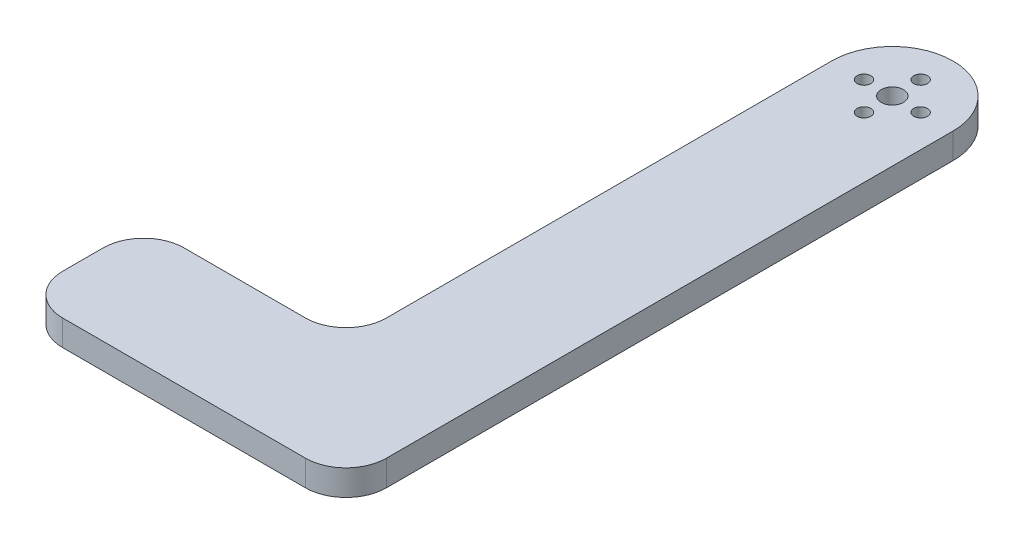
from build123d import *

# Parameters (mm, degrees)
BOSS_EXTRUDE1_DEPTH  = 6.35
M3_CLEARANCE_HOLE1_D = 3.4
CIRPATTERN1_COUNT    = 4
FILLET1_R            = 10
SKETCH5_R            = 2.75
CUT_EXTRUDE1_DEPTH   = 10


with BuildPart() as part:
    # Sketch2 → Boss-Extrude1 (new body)
    with BuildSketch(Plane(origin=(0, 0, 0), x_dir=(1, 0, 0), z_dir=(0, 1, 0))):
        with BuildLine():
            Line((15, -150), (15, 0))
            ThreePointArc((15, 0), (0, 15), (-15, 0))
            Line((-15, 0), (-15, -120))
            Line((-15, -120), (-65, -120))
            Line((-65, -120), (-65, -150))
            Line((-65, -150), (15, -150))
        make_face()
    extrude(amount=BOSS_EXTRUDE1_DEPTH)

    # M3 Clearance Hole1 (through all)
    with Locations(Plane(origin=(0, 6.35, 0), x_dir=(1, 0, 0), z_dir=(0, 1, 0))):
        with Locations((0, 7)):
            m3_clearance_hole1 = Hole(M3_CLEARANCE_HOLE1_D / 2)

    # CirPattern1: M3 Clearance Hole1 ×4 about axis
    cirpattern1_axis = Axis((0, 6.35, 0), (0, -1, 0))
    for i in range(1, CIRPATTERN1_COUNT):
        add(m3_clearance_hole1.rotate(cirpattern1_axis, i * 360 / CIRPATTERN1_COUNT), mode=Mode.SUBTRACT)

    # Fillet1
    fillet1_edges = [part.edges().sort_by_distance(p)[0] for p in [
        (15, 3.175, 150),
        (-65, 3.175, 150),
        (-65, 3.175, 120),
        (-15, 3.175, 120),
    ]]
    fillet(fillet1_edges, radius=FILLET1_R)

    # Sketch5 → Cut-Extrude1 (cut)
    with BuildSketch(Plane(origin=(0, 6.35, 0), x_dir=(1, 0, 0), z_dir=(0, 1, 0))):
        Circle(SKETCH5_R)
    extrude(amount=-CUT_EXTRUDE1_DEPTH, mode=Mode.SUBTRACT)


solid = part.part
